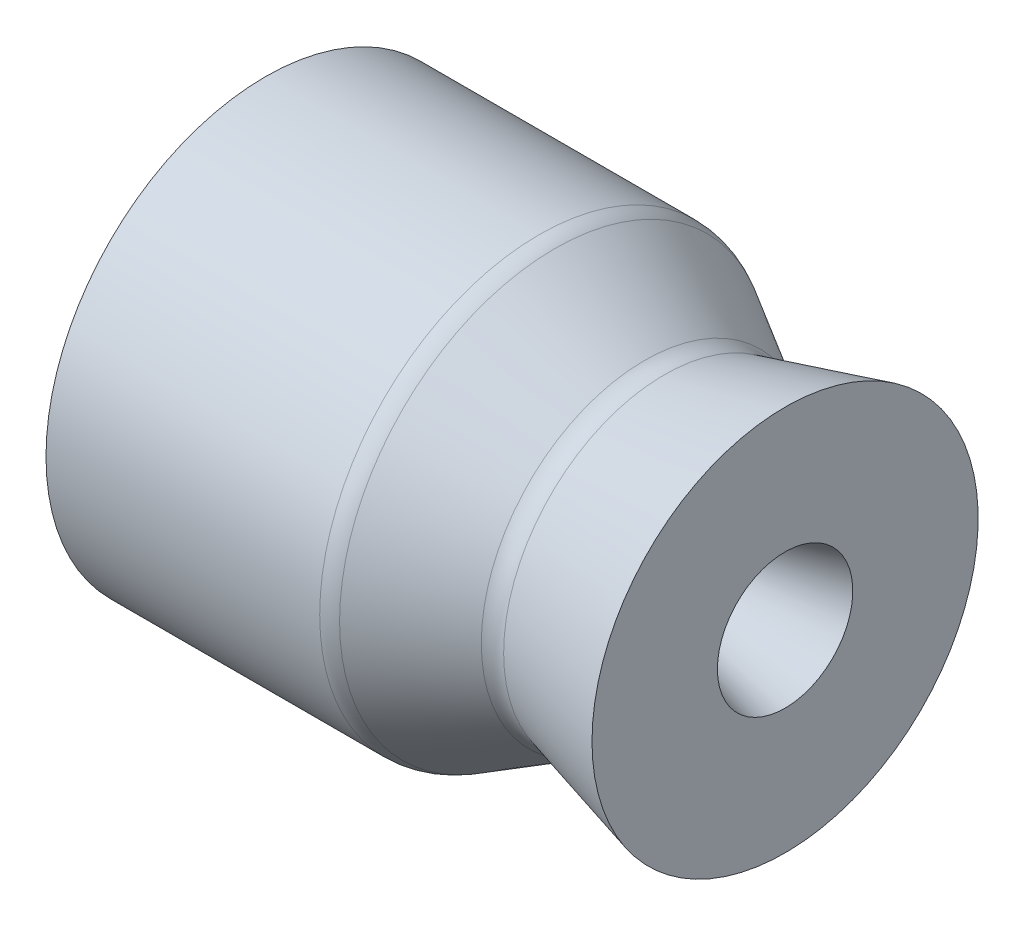
from build123d import *

# Parameters (mm, degrees)
CIRPATTERN1_COUNT = 6


with BuildPart() as part:
    # chamberNozzle → Revolve1 (revolve)
    with BuildSketch(Plane.XY):
        with BuildLine():
            Line((0, 38.1), (110.897045256, 38.1))
            ThreePointArc((110.897045256, 38.1), (114.184047129, 37.667257994), (117.247045256, 36.398522628))
            Line((117.247045256, 36.398522628), (153.648338424, 15.382226219))
            ThreePointArc((153.648338424, 15.382226219), (157.542961832, 14.060179716), (161.647049978, 14.329175865))
            Line((161.647049978, 14.329175865), (210.545228126, 27.431403211))
            Line((210.545228126, 27.431403211), (210.545228126, 78.231403211))
            Line((210.545228126, 78.231403211), (161.647049978, 65.129175865))
            ThreePointArc((161.647049978, 65.129175865), (157.542961832, 64.860179716), (153.648338424, 66.182226219))
            Line((153.648338424, 66.182226219), (117.247045256, 87.198522628))
            ThreePointArc((117.247045256, 87.198522628), (114.184047129, 88.467257994), (110.897045256, 88.9))
            Line((110.897045256, 88.9), (0, 88.9))
            Line((0, 88.9), (0, 55.88))
            Line((0, 55.88), (5.08, 55.88))
            Line((5.08, 55.88), (5.08, 45.72))
            Line((5.08, 45.72), (0, 45.72))
            Line((0, 45.72), (0, 38.1))
        make_face()
    revolve(axis=Axis((0, 0, 0), (1, 0, 0)))

    # Sketch3 → 1/2 (0.5) Diameter Hole1 (revolve, cut)
    with BuildSketch(Plane(origin=(0, 0, -72.39), x_dir=(0, 0, 1), z_dir=(0, 1, 0))):
        Polygon((0, 0), (0, 16.515464931), (6.35, 12.7), (6.35, 0.635), (6.985, 0), align=None)
    f_1_2_0_5_diameter_hole1 = revolve(axis=Axis((-6.35, 0, -72.39), (1, 0, 0)), mode=Mode.SUBTRACT)

    # CirPattern1: 1/2 (0.5) Diameter Hole1 ×6 about axis
    cirpattern1_axis = Axis((0, 0, 0), (-1, 0, 0))
    for i in range(1, CIRPATTERN1_COUNT):
        add(f_1_2_0_5_diameter_hole1.rotate(cirpattern1_axis, i * 360 / CIRPATTERN1_COUNT), mode=Mode.SUBTRACT)


solid = part.part
